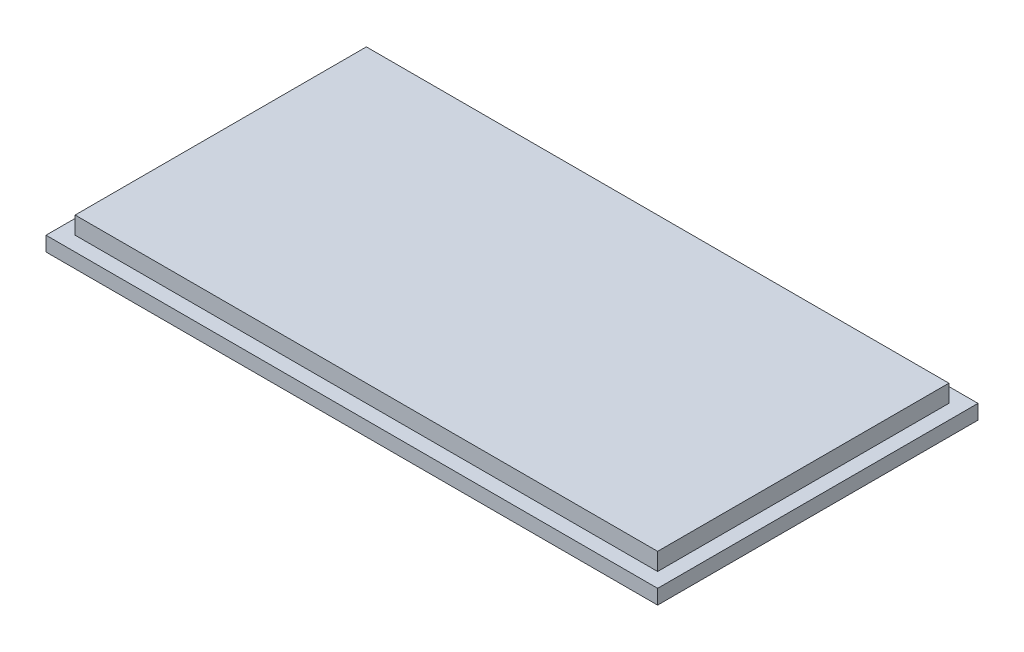
from build123d import *

# Parameters (mm, degrees)
SKETCH1_W           = 210
SKETCH1_H           = 110
BOSS_EXTRUDE1_DEPTH = 5
SKETCH2_W           = 200
SKETCH2_H           = 100
BOSS_EXTRUDE2_DEPTH = 6


with BuildPart() as part:
    # Sketch1 → Boss-Extrude1 (new body)
    with BuildSketch(Plane(origin=(0, 0, 0), x_dir=(1, 0, 0), z_dir=(0, 1, 0))):
        Rectangle(SKETCH1_W, SKETCH1_H)
    extrude(amount=BOSS_EXTRUDE1_DEPTH)

    # Sketch2 → Boss-Extrude2 (add)
    with BuildSketch(Plane(origin=(0, 5, 0), x_dir=(1, 0, 0), z_dir=(0, 1, 0))):
        Rectangle(SKETCH2_W, SKETCH2_H)
    extrude(amount=BOSS_EXTRUDE2_DEPTH)


solid = part.part
